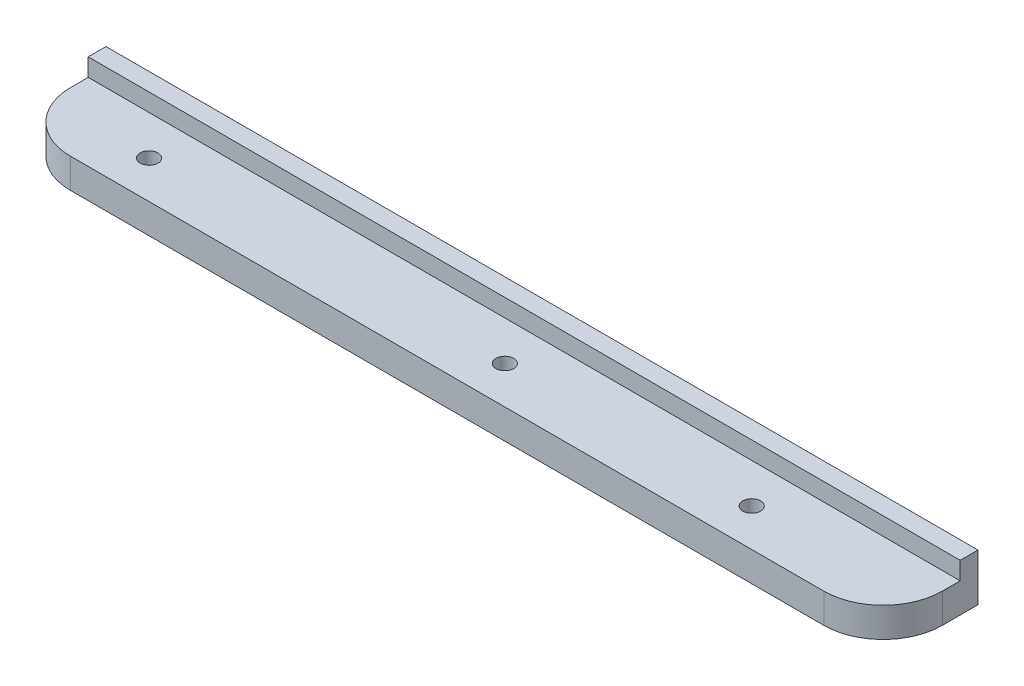
from build123d import *

# Parameters (mm, degrees)
BOSS_EXTRUDE1_DEPTH = 5
SKETCH3_W           = 147
SKETCH3_H           = 3
BOSS_EXTRUDE2_DEPTH = 3
FILLET1_R           = 10
FILLET2_R           = 10
SKETCH4_W           = 194.268756053
SKETCH4_H           = 72.725923545
CUT_EXTRUDE1_DEPTH  = 10


with BuildPart() as part:
    # Sketch2 → Boss-Extrude1 (new body)
    with BuildSketch(Plane(origin=(0, 0, 0), x_dir=(1, 0, 0), z_dir=(0, 1, 0))):
        Polygon((51.332898172, 11.229765013), (79.832898172, 11.229765013), (79.832898172, 37.229765013), (-67.167101828, 37.229765013), (-67.167101828, 11.229765013), (-50.267101828, 11.229765013), (9.722898172, 11.229765013), align=None)
        with BuildLine():
            ThreePointArc((-48.767101828, 17.579765013), (-49.206441656, 16.519104841), (-50.267101828, 16.079765013))
            ThreePointArc((-50.267101828, 16.079765013), (-51.327761999, 18.640425185), (-48.767101828, 17.579765013))
        make_face(mode=Mode.SUBTRACT)
        with BuildLine():
            ThreePointArc((11.222898172, 17.579765013), (9.722898172, 16.079765013), (8.222898172, 17.579765013))
            ThreePointArc((8.222898172, 17.579765013), (9.722898172, 19.079765013), (11.222898172, 17.579765013))
        make_face(mode=Mode.SUBTRACT)
        with BuildLine():
            ThreePointArc((52.832898172, 17.579765013), (51.332898172, 16.079765013), (49.832898172, 17.579765013))
            ThreePointArc((49.832898172, 17.579765013), (51.332898172, 19.079765013), (52.832898172, 17.579765013))
        make_face(mode=Mode.SUBTRACT)
    extrude(amount=BOSS_EXTRUDE1_DEPTH)

    # Sketch3 → Boss-Extrude2 (add)
    with BuildSketch(Plane(origin=(0, 5, 0), x_dir=(1, 0, 0), z_dir=(0, 1, 0))):
        with Locations((6.332898172, 25.729765013)):
            Rectangle(SKETCH3_W, SKETCH3_H)
    extrude(amount=BOSS_EXTRUDE2_DEPTH)

    # Fillet1
    fillet1_edges = [part.edges().sort_by_distance(p)[0] for p in [
        (-67.167101828, 2.5, -11.229765013),
        (-67.167101828, 2.5, -37.229765013),
    ]]
    fillet(fillet1_edges, radius=FILLET1_R)

    # Fillet2
    fillet2_edges = [part.edges().sort_by_distance(p)[0] for p in [
        (79.832898172, 2.5, -11.229765013),
        (79.832898172, 2.5, -37.229765013),
    ]]
    fillet(fillet2_edges, radius=FILLET2_R)

    # Sketch4 → Cut-Extrude1 (cut)
    with BuildSketch(Plane(origin=(0, 0, -37.229765013), x_dir=(-1, 0, 0), z_dir=(0, 0, -1))):
        with Locations((1.63687335, -5.593113251)):
            Rectangle(SKETCH4_W, SKETCH4_H)
    extrude(amount=-CUT_EXTRUDE1_DEPTH, mode=Mode.SUBTRACT)


solid = part.part
